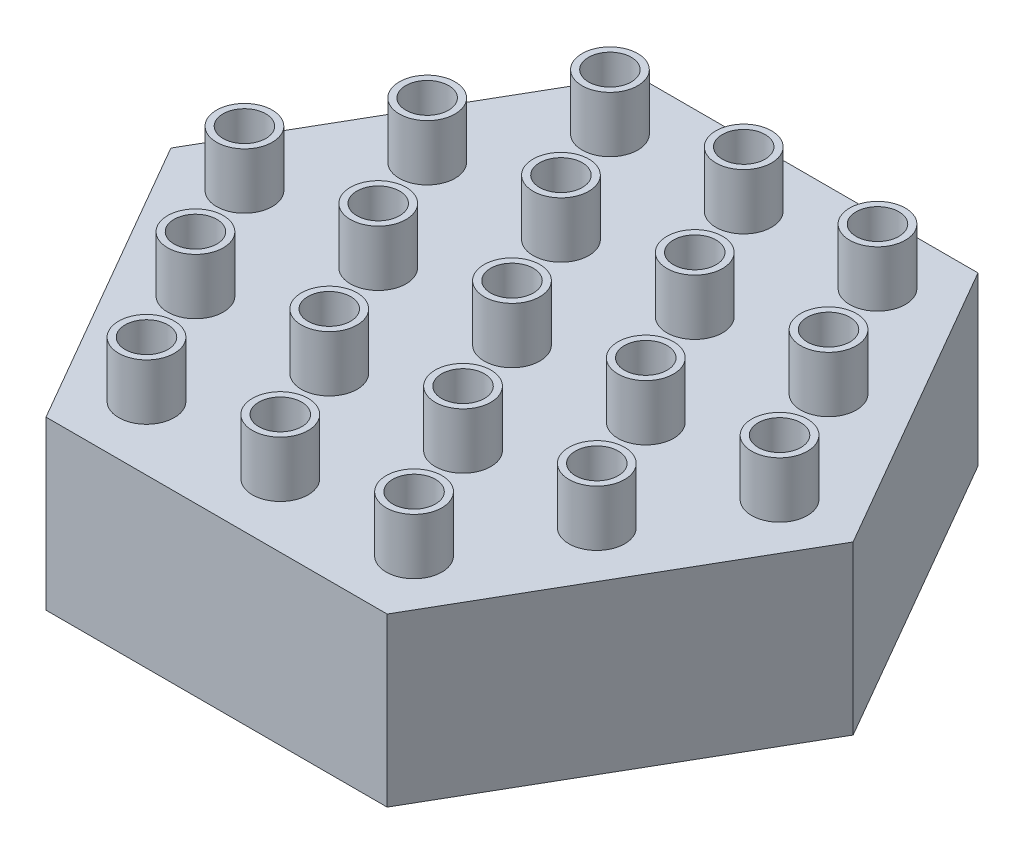
from build123d import *

# Parameters (mm, degrees)
BOSS_EXTRUDE1_DEPTH = 4
CAVITY1_START       = 3
CAVITY1_OUTLINE_R   = 0.5
CAVITY1_OUTLINE_R_2 = 0.384
CAVITY1_DEPTH       = 1
CAVITY1_2_DEPTH     = 3
CAVITY1_START_2     = 1
CAVITY1_3_OUTLINE_R = 0.384
CAVITY1_3_DEPTH     = 2


# Read off the part's stored shape, not the designer's step: Cavity1
with BuildPart() as part:
    # Sketch1 → Boss-Extrude1 (new body)
    with BuildSketch(Plane(origin=(0, 0, 0), x_dir=(1, 0, 0), z_dir=(0, 1, 0))):
        Polygon((6.92820323, 0), (3.464101615, 6), (-3.464101615, 6), (-6.92820323, 0), (-3.464101615, -6), (3.464101615, -6), align=None)
    extrude(amount=BOSS_EXTRUDE1_DEPTH)

    # Cavity1 outline → Cavity1 (cut)
    # profile 1 of 20: a face of its own
    with BuildSketch(Plane(origin=(0, 0, 0), x_dir=(1, 0, 0), z_dir=(0, 1, 0)).offset(CAVITY1_START)):
        Polygon((3.464101615, -6), (6.92820323, 0), (3.464101615, 6), (-3.464101615, 6), (-6.92820323, 0), (-3.464101615, -6), align=None)
        with Locations((-2.053589838, -4.156921938)):
            Circle(CAVITY1_OUTLINE_R, mode=Mode.SUBTRACT)
        with Locations((-4.453589838, 0)):
            Circle(CAVITY1_OUTLINE_R, mode=Mode.SUBTRACT)
        with Locations((-3.253589838, -2.078460969)):
            Circle(CAVITY1_OUTLINE_R, mode=Mode.SUBTRACT)
        with Locations((-0.853589838, -2.078460969)):
            Circle(CAVITY1_OUTLINE_R, mode=Mode.SUBTRACT)
        with Locations((-2.053589838, 0)):
            Circle(CAVITY1_OUTLINE_R, mode=Mode.SUBTRACT)
        with Locations((0.346410162, -4.156921938)):
            Circle(CAVITY1_OUTLINE_R, mode=Mode.SUBTRACT)
        with Locations((2.746410162, -4.156921938)):
            Circle(CAVITY1_OUTLINE_R, mode=Mode.SUBTRACT)
        with Locations((1.546410162, -2.078460969)):
            Circle(CAVITY1_OUTLINE_R, mode=Mode.SUBTRACT)
        with Locations((0.346410162, 0)):
            Circle(CAVITY1_OUTLINE_R, mode=Mode.SUBTRACT)
        with Locations((2.746410162, 0)):
            Circle(CAVITY1_OUTLINE_R, mode=Mode.SUBTRACT)
        with Locations((3.946410162, -2.078460969)):
            Circle(CAVITY1_OUTLINE_R, mode=Mode.SUBTRACT)
        with Locations((5.146410162, 0)):
            Circle(CAVITY1_OUTLINE_R, mode=Mode.SUBTRACT)
        with Locations((-3.253589838, 2.078460969)):
            Circle(CAVITY1_OUTLINE_R, mode=Mode.SUBTRACT)
        with Locations((-0.853589838, 2.078460969)):
            Circle(CAVITY1_OUTLINE_R, mode=Mode.SUBTRACT)
        with Locations((-2.053589838, 4.156921938)):
            Circle(CAVITY1_OUTLINE_R, mode=Mode.SUBTRACT)
        with Locations((1.546410162, 2.078460969)):
            Circle(CAVITY1_OUTLINE_R, mode=Mode.SUBTRACT)
        with Locations((3.946410162, 2.078460969)):
            Circle(CAVITY1_OUTLINE_R, mode=Mode.SUBTRACT)
        with Locations((0.346410162, 4.156921938)):
            Circle(CAVITY1_OUTLINE_R, mode=Mode.SUBTRACT)
        with Locations((2.746410162, 4.156921938)):
            Circle(CAVITY1_OUTLINE_R, mode=Mode.SUBTRACT)
    # profile 2 of 20: a face of its own
    with BuildSketch(Plane(origin=(0, 0, 0), x_dir=(1, 0, 0), z_dir=(0, 1, 0)).offset(CAVITY1_START)):
        with Locations((0.346410162, 0)):
            Circle(CAVITY1_OUTLINE_R_2)
    # profile 3 of 20: a face of its own
    with BuildSketch(Plane(origin=(0, 0, 0), x_dir=(1, 0, 0), z_dir=(0, 1, 0)).offset(CAVITY1_START)):
        with Locations((3.946410162, 2.078460969)):
            Circle(CAVITY1_OUTLINE_R_2)
    # profile 4 of 20: a face of its own
    with BuildSketch(Plane(origin=(0, 0, 0), x_dir=(1, 0, 0), z_dir=(0, 1, 0)).offset(CAVITY1_START)):
        with Locations((5.146410162, 0)):
            Circle(CAVITY1_OUTLINE_R_2)
    # profile 5 of 20: a face of its own
    with BuildSketch(Plane(origin=(0, 0, 0), x_dir=(1, 0, 0), z_dir=(0, 1, 0)).offset(CAVITY1_START)):
        with Locations((2.746410162, 0)):
            Circle(CAVITY1_OUTLINE_R_2)
    # profile 6 of 20: a face of its own
    with BuildSketch(Plane(origin=(0, 0, 0), x_dir=(1, 0, 0), z_dir=(0, 1, 0)).offset(CAVITY1_START)):
        with Locations((0.346410162, 4.156921938)):
            Circle(CAVITY1_OUTLINE_R_2)
    # profile 7 of 20: a face of its own
    with BuildSketch(Plane(origin=(0, 0, 0), x_dir=(1, 0, 0), z_dir=(0, 1, 0)).offset(CAVITY1_START)):
        with Locations((2.746410162, 4.156921938)):
            Circle(CAVITY1_OUTLINE_R_2)
    # profile 8 of 20: a face of its own
    with BuildSketch(Plane(origin=(0, 0, 0), x_dir=(1, 0, 0), z_dir=(0, 1, 0)).offset(CAVITY1_START)):
        with Locations((1.546410162, 2.078460969)):
            Circle(CAVITY1_OUTLINE_R_2)
    # profile 9 of 20: a face of its own
    with BuildSketch(Plane(origin=(0, 0, 0), x_dir=(1, 0, 0), z_dir=(0, 1, 0)).offset(CAVITY1_START)):
        with Locations((-3.253589838, 2.078460969)):
            Circle(CAVITY1_OUTLINE_R_2)
    # profile 10 of 20: a face of its own
    with BuildSketch(Plane(origin=(0, 0, 0), x_dir=(1, 0, 0), z_dir=(0, 1, 0)).offset(CAVITY1_START)):
        with Locations((-2.053589838, 4.156921938)):
            Circle(CAVITY1_OUTLINE_R_2)
    # profile 11 of 20: a face of its own
    with BuildSketch(Plane(origin=(0, 0, 0), x_dir=(1, 0, 0), z_dir=(0, 1, 0)).offset(CAVITY1_START)):
        with Locations((-0.853589838, 2.078460969)):
            Circle(CAVITY1_OUTLINE_R_2)
    # profile 12 of 20: a face of its own
    with BuildSketch(Plane(origin=(0, 0, 0), x_dir=(1, 0, 0), z_dir=(0, 1, 0)).offset(CAVITY1_START)):
        with Locations((-3.253589838, -2.078460969)):
            Circle(CAVITY1_OUTLINE_R_2)
    # profile 13 of 20: a face of its own
    with BuildSketch(Plane(origin=(0, 0, 0), x_dir=(1, 0, 0), z_dir=(0, 1, 0)).offset(CAVITY1_START)):
        with Locations((-4.453589838, 0)):
            Circle(CAVITY1_OUTLINE_R_2)
    # profile 14 of 20: a face of its own
    with BuildSketch(Plane(origin=(0, 0, 0), x_dir=(1, 0, 0), z_dir=(0, 1, 0)).offset(CAVITY1_START)):
        with Locations((-2.053589838, 0)):
            Circle(CAVITY1_OUTLINE_R_2)
    # profile 15 of 20: a face of its own
    with BuildSketch(Plane(origin=(0, 0, 0), x_dir=(1, 0, 0), z_dir=(0, 1, 0)).offset(CAVITY1_START)):
        with Locations((0.346410162, -4.156921938)):
            Circle(CAVITY1_OUTLINE_R_2)
    # profile 16 of 20: a face of its own
    with BuildSketch(Plane(origin=(0, 0, 0), x_dir=(1, 0, 0), z_dir=(0, 1, 0)).offset(CAVITY1_START)):
        with Locations((-2.053589838, -4.156921938)):
            Circle(CAVITY1_OUTLINE_R_2)
    # profile 17 of 20: a face of its own
    with BuildSketch(Plane(origin=(0, 0, 0), x_dir=(1, 0, 0), z_dir=(0, 1, 0)).offset(CAVITY1_START)):
        with Locations((-0.853589838, -2.078460969)):
            Circle(CAVITY1_OUTLINE_R_2)
    # profile 18 of 20: a face of its own
    with BuildSketch(Plane(origin=(0, 0, 0), x_dir=(1, 0, 0), z_dir=(0, 1, 0)).offset(CAVITY1_START)):
        with Locations((3.946410162, -2.078460969)):
            Circle(CAVITY1_OUTLINE_R_2)
    # profile 19 of 20: a face of its own
    with BuildSketch(Plane(origin=(0, 0, 0), x_dir=(1, 0, 0), z_dir=(0, 1, 0)).offset(CAVITY1_START)):
        with Locations((2.746410162, -4.156921938)):
            Circle(CAVITY1_OUTLINE_R_2)
    # profile 20 of 20: a face of its own
    with BuildSketch(Plane(origin=(0, 0, 0), x_dir=(1, 0, 0), z_dir=(0, 1, 0)).offset(CAVITY1_START)):
        with Locations((1.546410162, -2.078460969)):
            Circle(CAVITY1_OUTLINE_R_2)
    extrude(amount=CAVITY1_DEPTH, mode=Mode.SUBTRACT)

    # Cavity1 2 outline → Cavity1 2 (cut)
    with BuildSketch(Plane(origin=(0, 0, 0), x_dir=(1, 0, 0), z_dir=(0, 1, 0))):
        Polygon((3.464101615, -6), (6.92820323, 0), (3.464101615, 6), (-3.464101615, 6), (-6.92820323, 0), (-3.464101615, -6), align=None)
        Polygon((6.466323015, 0), (3.406366588, -5.3), (-2.713546265, -5.3), (-5.773502692, 0), (-2.713546265, 5.3), (3.406366588, 5.3), align=None, mode=Mode.SUBTRACT)
    extrude(amount=CAVITY1_2_DEPTH, mode=Mode.SUBTRACT)

    # Cavity1 3 outline → Cavity1 3 (cut)
    with BuildSketch(Plane(origin=(0, 0, 0), x_dir=(1, 0, 0), z_dir=(0, 1, 0)).offset(CAVITY1_START_2)):
        with Locations((0.346410162, 0)):
            Circle(CAVITY1_3_OUTLINE_R)
        with Locations((3.946410162, 2.078460969)):
            Circle(CAVITY1_3_OUTLINE_R)
        with Locations((5.146410162, 0)):
            Circle(CAVITY1_3_OUTLINE_R)
        with Locations((2.746410162, 0)):
            Circle(CAVITY1_3_OUTLINE_R)
        with Locations((0.346410162, 4.156921938)):
            Circle(CAVITY1_3_OUTLINE_R)
        with Locations((2.746410162, 4.156921938)):
            Circle(CAVITY1_3_OUTLINE_R)
        with Locations((1.546410162, 2.078460969)):
            Circle(CAVITY1_3_OUTLINE_R)
        with Locations((-3.253589838, 2.078460969)):
            Circle(CAVITY1_3_OUTLINE_R)
        with Locations((-2.053589838, 4.156921938)):
            Circle(CAVITY1_3_OUTLINE_R)
        with Locations((-0.853589838, 2.078460969)):
            Circle(CAVITY1_3_OUTLINE_R)
        with Locations((-3.253589838, -2.078460969)):
            Circle(CAVITY1_3_OUTLINE_R)
        with Locations((-4.453589838, 0)):
            Circle(CAVITY1_3_OUTLINE_R)
        with Locations((-2.053589838, 0)):
            Circle(CAVITY1_3_OUTLINE_R)
        with Locations((0.346410162, -4.156921938)):
            Circle(CAVITY1_3_OUTLINE_R)
        with Locations((-2.053589838, -4.156921938)):
            Circle(CAVITY1_3_OUTLINE_R)
        with Locations((-0.853589838, -2.078460969)):
            Circle(CAVITY1_3_OUTLINE_R)
        with Locations((3.946410162, -2.078460969)):
            Circle(CAVITY1_3_OUTLINE_R)
        with Locations((2.746410162, -4.156921938)):
            Circle(CAVITY1_3_OUTLINE_R)
        with Locations((1.546410162, -2.078460969)):
            Circle(CAVITY1_3_OUTLINE_R)
    extrude(amount=CAVITY1_3_DEPTH, mode=Mode.SUBTRACT)


solid = part.part
